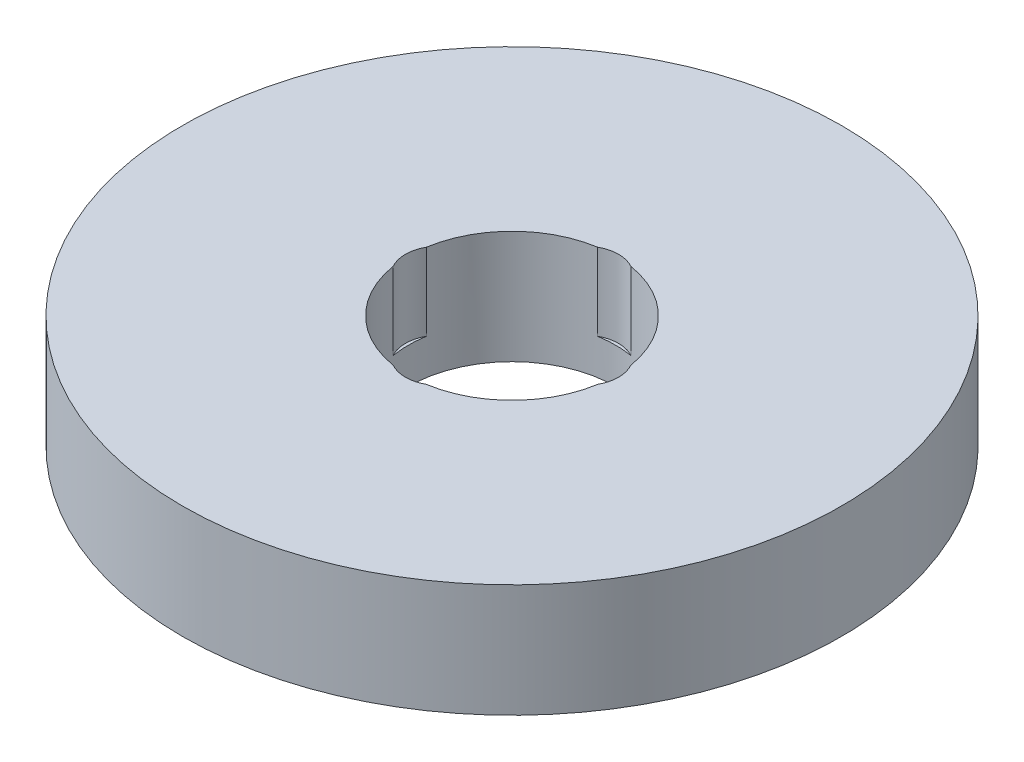
from build123d import *

# Parameters (mm, degrees)
SKETCH1_R           = 87.5
BOSS_EXTRUDE1_DEPTH = 30
SKETCH2_R           = 27.5
CUT_EXTRUDE1_DEPTH  = 128.328315782
SKETCH3_R           = 9.054511307
CUT_EXTRUDE2_DEPTH  = 20.492021181
CIRPATTERN1_COUNT   = 4


with BuildPart() as part:
    # Sketch1 → Boss-Extrude1 (new body)
    with BuildSketch(Plane(origin=(0, 0, 0), x_dir=(1, 0, 0), z_dir=(0, 1, 0))):
        Circle(SKETCH1_R)
    extrude(amount=BOSS_EXTRUDE1_DEPTH)

    # Sketch2 → Cut-Extrude1 (cut, through all)
    with BuildSketch(Plane(origin=(0, 0, 0), x_dir=(1, 0, 0), z_dir=(0, 1, 0))):
        Circle(SKETCH2_R)
    extrude(amount=CUT_EXTRUDE1_DEPTH, mode=Mode.SUBTRACT)

    # Sketch3 → Cut-Extrude2 (cut)
    with BuildSketch(Plane(origin=(0, 30, 0), x_dir=(1, 0, 0), z_dir=(0, 1, 0))):
        with Locations((-19.229183332, 0)):
            Circle(SKETCH3_R)
    cut_extrude2 = extrude(amount=-CUT_EXTRUDE2_DEPTH, mode=Mode.SUBTRACT)

    # CirPattern1: Cut-Extrude2 ×4 about axis
    cirpattern1_axis = Axis((0, 0, 0), (0, 1, 0))
    for i in range(1, CIRPATTERN1_COUNT):
        add(cut_extrude2.rotate(cirpattern1_axis, i * 360 / CIRPATTERN1_COUNT), mode=Mode.SUBTRACT)


solid = part.part
